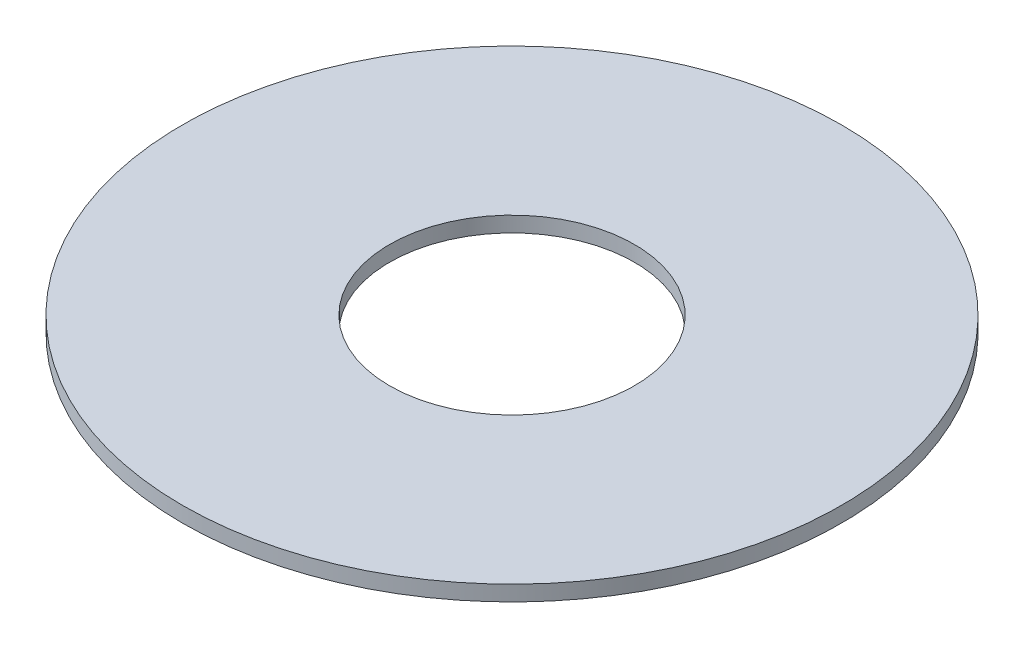
from build123d import *

# Parameters (mm, degrees)
SKETCH1_R           = 42.725
SKETCH1_R_2         = 15.875
BOSS_EXTRUDE1_DEPTH = 2


with BuildPart() as part:
    # Sketch1 → Boss-Extrude1 (new body)
    with BuildSketch(Plane(origin=(0, 0, 0), x_dir=(1, 0, 0), z_dir=(0, 1, 0))):
        Circle(SKETCH1_R)
        Circle(SKETCH1_R_2, mode=Mode.SUBTRACT)
    extrude(amount=BOSS_EXTRUDE1_DEPTH)


solid = part.part
